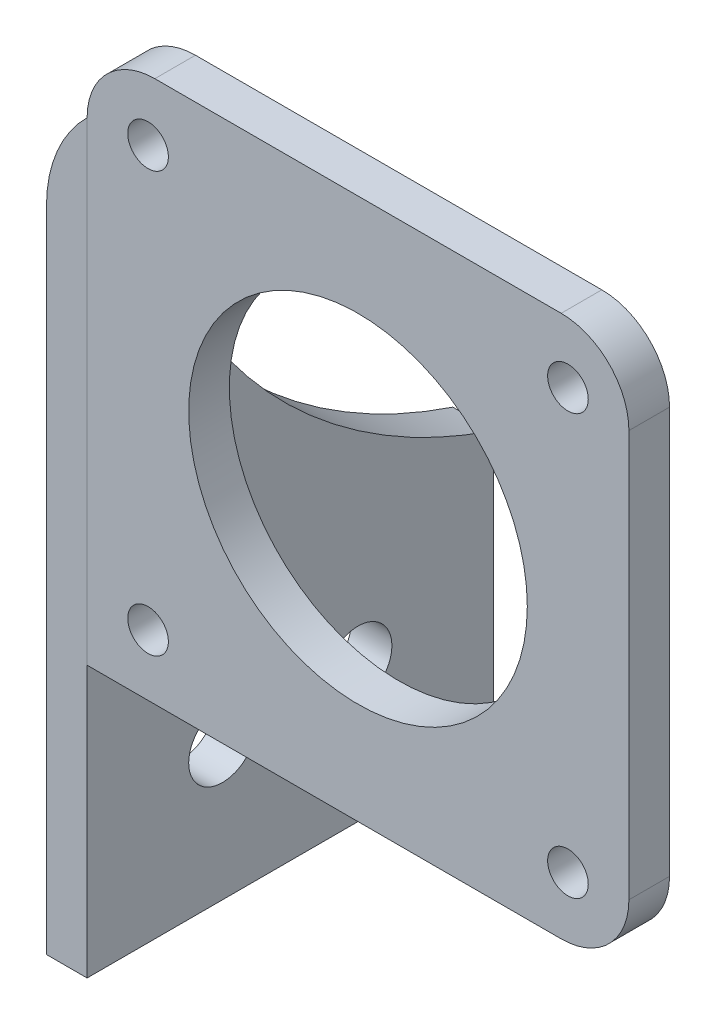
from build123d import *

# Parameters (mm, degrees)
SKETCH1_R           = 12.5
SKETCH1_R_2         = 1.5
BOSS_EXTRUDE1_DEPTH = 3
SKETCH2_R           = 2.5
BOSS_EXTRUDE2_DEPTH = 3
FILLET1_R           = 10


with BuildPart() as part:
    # Sketch1 → Boss-Extrude1 (new body)
    with BuildSketch(Plane.XY):
        with BuildLine():
            Line((-15, -20), (15, -20))
            ThreePointArc((15, -20), (18.535533906, -18.535533906), (20, -15))
            Line((20, -15), (20, 15))
            ThreePointArc((20, 15), (18.535533906, 18.535533906), (15, 20))
            Line((15, 20), (-15, 20))
            ThreePointArc((-15, 20), (-18.535533906, 18.535533906), (-20, 15))
            Line((-20, 15), (-20, -15))
            Line((-20, -15), (-20, -20))
            Line((-20, -20), (-15, -20))
        make_face()
        Circle(SKETCH1_R, mode=Mode.SUBTRACT)
        with Locations((-15.5, 15.5)):
            Circle(SKETCH1_R_2, mode=Mode.SUBTRACT)
        with Locations((15.5, 15.5)):
            Circle(SKETCH1_R_2, mode=Mode.SUBTRACT)
        with Locations((-15.5, -15.5)):
            Circle(SKETCH1_R_2, mode=Mode.SUBTRACT)
        with Locations((15.5, -15.5)):
            Circle(SKETCH1_R_2, mode=Mode.SUBTRACT)
    extrude(amount=BOSS_EXTRUDE1_DEPTH)


with BuildPart() as body_2:
    # Sketch2 → Boss-Extrude2 (new body)
    with BuildSketch(Plane.ZY.offset(20)):
        with BuildLine():
            Line((3, -40), (-27, -40))
            Line((-27, -40), (-27, -20))
            ThreePointArc((-27, -20), (-8.164746619, -6.615766894), (0, 15))
            Line((0, 15), (3, 15))
            Line((3, 15), (3, -40))
        make_face()
        with Locations((-17, -30)):
            Circle(SKETCH2_R, mode=Mode.SUBTRACT)
        with Locations((-7, -30)):
            Circle(SKETCH2_R, mode=Mode.SUBTRACT)
    extrude(amount=BOSS_EXTRUDE2_DEPTH)

    # Fillet1
    # the kernel refuses this fillet: 10 mm, written as the material it takes off along each edge
    with BuildSketch(Plane(origin=(-23, 15, -17.853571071), x_dir=(1, 0, 0), z_dir=(0, 0, 1))) as fillet1_piece_1:
        with BuildLine():
            CenterArc((10, -7.141428429), FILLET1_R, 134.427004001, 45.572995999)
            Line((0, -7.141428429), (-0.2, -7.141428429))
            Line((-0.2, -7.141428429), (-0.2, 0))
            Line((-0.2, 0), (0, 0.2))
            ThreePointArc((0, 0.2), (1.5, 0.2), (2.86, 0.142828569))
            Line((2.86, 0.142828569), (3, 0))
        make_face()
    extrude(amount=38.707142143, mode=Mode.SUBTRACT)


solid = Compound([part.part, body_2.part])
